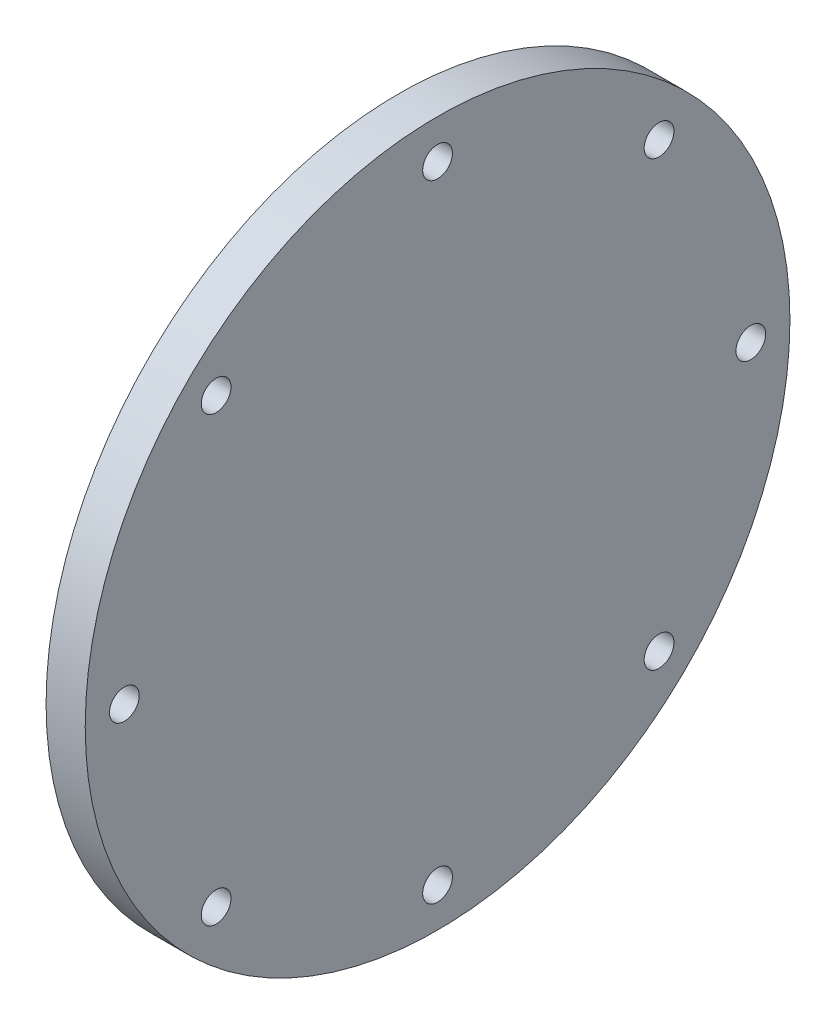
from build123d import *

# Parameters (mm, degrees)
SKETCH1_R           = 57.15
BOSS_EXTRUDE1_DEPTH = 6.35
SKETCH2_R           = 45.847
BOSS_EXTRUDE2_DEPTH = 6.35
SKETCH3_R           = 2.413
CUT_EXTRUDE1_DEPTH  = 82.814026915


with BuildPart() as part:
    # Sketch1 → Boss-Extrude1 (new body)
    with BuildSketch(Plane(origin=(0, 0, 0), x_dir=(0, 0, -1), z_dir=(1, 0, 0))):
        Circle(SKETCH1_R)
    extrude(amount=BOSS_EXTRUDE1_DEPTH)

    # Sketch2 → Boss-Extrude2 (add)
    with BuildSketch(Plane.ZY):
        Circle(SKETCH2_R)
    extrude(amount=BOSS_EXTRUDE2_DEPTH)

    # Sketch3 → Cut-Extrude1 (cut, through all)
    with BuildSketch(Plane(origin=(6.35, 0, 0), x_dir=(0, 0, -1), z_dir=(1, 0, 0))):
        with Locations((0, 50.8)):
            Circle(SKETCH3_R)
        with Locations((35.921024484, 35.921024484)):
            Circle(SKETCH3_R)
        with Locations((50.8, 0)):
            Circle(SKETCH3_R)
        with Locations((35.921024484, -35.921024484)):
            Circle(SKETCH3_R)
        with Locations((0, -50.8)):
            Circle(SKETCH3_R)
        with Locations((-35.921024484, -35.921024484)):
            Circle(SKETCH3_R)
        with Locations((-50.8, 0)):
            Circle(SKETCH3_R)
        with Locations((-35.921024484, 35.921024484)):
            Circle(SKETCH3_R)
    extrude(amount=-CUT_EXTRUDE1_DEPTH, mode=Mode.SUBTRACT)


solid = part.part
